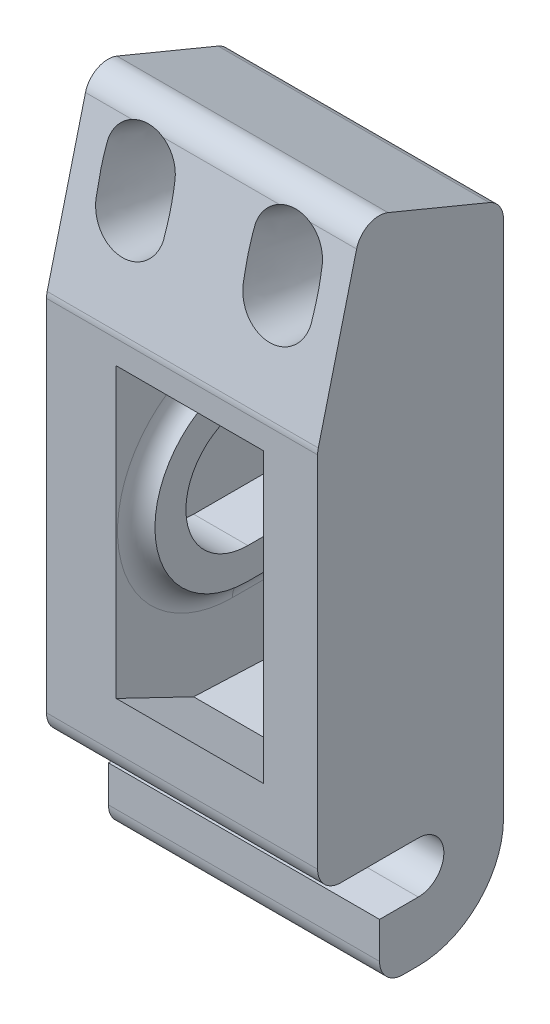
from build123d import *

# Parameters (mm, degrees)
SKETCH1_W              = 17.5
SKETCH1_H              = 44
BLOCK_DEPTH            = 12
BEARINGHOLECOVER_REACH = 49.424
HINGEHOLE_REACH        = 50.849
SKETCH4_R              = 1.65
SKETCH5_W              = 4
SKETCH5_H              = 3.85
HINGEHOLECLEAR1_DEPTH  = 49.849257951
SKETCH8_W              = 6.5
SKETCH8_H              = 3.3
HINGEHOLECLEAR2_DEPTH  = 49.849257951
BEARINGAXIS_DEPTH      = 12
BEARINGAXIS_DEPTH_BACK = 2.5
SKETCH16_W             = 1
SKETCH16_H             = 2
SKETCH18_W             = 1
SKETCH18_H             = 2
SWEEPFILLET_R          = 1.5
HINGEFILLET_R          = 5.5
CUT_REACH              = 50.849
CHAMFER_START          = 36.9551813
CHAMFER_2_OUTLINE_W    = 20
CHAMFER_2_OUTLINE_H    = 13
CHAMFER_2_DEPTH        = 5.0448187
FILLET15MM_START       = -1
FILLET15MM_DEPTH       = 19


with BuildPart() as part:
    # Sketch1 → Block (new body)
    with BuildSketch(Plane.XY):
        with Locations((8.75, 22)):
            Rectangle(SKETCH1_W, SKETCH1_H)
    extrude(amount=BLOCK_DEPTH)

    # Sketch2 → BearingHole section 0
    with BuildSketch(Plane.XY.offset(12)):
        with BuildLine():
            Line((4.5, 9.5), (14, 9.5))
            Line((14, 9.5), (14, 32.5))
            Line((14, 32.5), (4.5, 32.5))
            Line((4.5, 32.5), (4.5, 9.5))
        make_face()
    # Sketch3 → BearingHole section 1
    with BuildSketch(Plane(origin=(0, 0, 0), x_dir=(-1, 0, 0), z_dir=(0, 0, -1))):
        with BuildLine():
            Line((-14, 9), (-4.5, 9))
            Line((-4.5, 9), (-4.5, 33))
            Line((-4.5, 33), (-14, 33))
            Line((-14, 33), (-14, 9))
        make_face()
    loft(mode=Mode.SUBTRACT)

    # Sketch32 → BearingHoleCover (add, up to next)
    with BuildSketch(Plane(origin=(4.5, 0, 0), x_dir=(0, 0, -1), z_dir=(1, 0, 0)), mode=Mode.PRIVATE) as bearingholecover_sk1:
        Polygon((-12, 32.5), (-7, 32.708333333), (-12, 30.3), align=None)
    bearingholecover_tool1 = extrude(bearingholecover_sk1.sketch, amount=BEARINGHOLECOVER_REACH, mode=Mode.PRIVATE) - part.part
    # Sketch32 → BearingHoleCover (add, up to next)
    with BuildSketch(Plane(origin=(4.5, 0, 0), x_dir=(0, 0, -1), z_dir=(1, 0, 0)), mode=Mode.PRIVATE) as bearingholecover_sk2:
        Polygon((-12, 9.5), (-7, 9.291666667), (-12, 11.7), align=None)
    bearingholecover_tool2 = extrude(bearingholecover_sk2.sketch, amount=BEARINGHOLECOVER_REACH, mode=Mode.PRIVATE) - part.part
    add(bearingholecover_tool1.solids().sort_by_distance((4.5, 31.836111, 10.333333))[0])
    add(bearingholecover_tool2.solids().sort_by_distance((4.5, 10.163889, 10.333333))[0])

    # Sketch4 → HingeHole (cut, up to next)
    with BuildSketch(Plane(origin=(17.5, 0, 0), x_dir=(0, 0, -1), z_dir=(1, 0, 0)), mode=Mode.PRIVATE) as hingehole_sk1:
        with Locations((-5.5, 5.5)):
            Circle(SKETCH4_R)
    hingehole_tool1 = extrude(hingehole_sk1.sketch, amount=-HINGEHOLE_REACH, mode=Mode.PRIVATE) & part.part
    add(hingehole_tool1.solids().sort_by_distance((17.5, 5.5, 5.5))[0], mode=Mode.SUBTRACT)

    # Sketch5 → HingeHoleClear1 (cut, through all)
    with BuildSketch(Plane(origin=(17.5, 0, 0), x_dir=(0, 0, -1), z_dir=(1, 0, 0))):
        with Locations((-10, 1.925)):
            Rectangle(SKETCH5_W, SKETCH5_H)
    extrude(amount=-HINGEHOLECLEAR1_DEPTH, mode=Mode.SUBTRACT)

    # Sketch8 → HingeHoleClear2 (cut, through all)
    with BuildSketch(Plane(origin=(17.5, 0, 0), x_dir=(0, 0, -1), z_dir=(1, 0, 0))):
        with Locations((-8.75, 5.5)):
            Rectangle(SKETCH8_W, SKETCH8_H)
    extrude(amount=-HINGEHOLECLEAR2_DEPTH, mode=Mode.SUBTRACT)

    # Sketch10 → BearingAxis (cut, two sides: drawn at the far end of the back side and taken through both)
    with BuildSketch(Plane(origin=(4.5, 0, 0), x_dir=(0, 0, -1), z_dir=(1, 0, 0)).offset(-BEARINGAXIS_DEPTH_BACK)):
        with BuildLine():
            Line((0, 25), (-4.5, 25))
            ThreePointArc((-4.5, 25), (-8.5, 21), (-4.5, 17))
            Line((-4.5, 17), (0, 17))
            Line((0, 17), (0, 25))
        make_face()
    extrude(amount=BEARINGAXIS_DEPTH + BEARINGAXIS_DEPTH_BACK, mode=Mode.SUBTRACT)

    # Sweep1: sweep along a path in Sketch15
    with BuildLine(Plane(origin=(4.5, 0, 0), x_dir=(0, 0, -1), z_dir=(1, 0, 0))) as sweep1_path:
        Line((0, 17), (-4.5, 17))
        ThreePointArc((-4.5, 17), (-8.5, 21), (-4.5, 25))
        Line((-4.5, 25), (0, 25))
    # Sketch16 → Sweep1 (sweep)
    with BuildSketch(Plane(origin=(0, 0, 0), x_dir=(-1, 0, 0), z_dir=(0, 0, -1))):
        with Locations((-5, 26)):
            Rectangle(SKETCH16_W, SKETCH16_H)
    sweep(path=sweep1_path.line)

    # Sweep2: sweep along a path in Sketch17
    with BuildLine(Plane.ZY.offset(-14)) as sweep2_path:
        Line((0, 17), (4.5, 17))
        ThreePointArc((4.5, 17), (8.5, 21), (4.5, 25))
        Line((4.5, 25), (0, 25))
    # Sketch18 → Sweep2 (sweep)
    with BuildSketch(Plane(origin=(0, 0, 0), x_dir=(-1, 0, 0), z_dir=(0, 0, -1))):
        with Locations((-13.5, 26)):
            Rectangle(SKETCH18_W, SKETCH18_H)
    sweep(path=sweep2_path.line)

    # SweepFillet
    # the kernel refuses this fillet: 1.5 mm, written as the material it adds along each edge
    with BuildSketch(Plane(origin=(4.5, 15, 0), x_dir=(0, -1, 0), z_dir=(0, 0, 1)), Plane(origin=(4.5, 27, 4.5), x_dir=(0, 1, 0), z_dir=(0, 0, -1))) as sweepfillet_piece_1:
        with BuildLine():
            CenterArc((1.414213562, 1.5), SWEEPFILLET_R, 199.471220634, 70.528779366)
            Line((0, 1), (-0.028284271, 0.99))
            ThreePointArc((-0.028284271, 0.99), (-0.03, 0.5), (-0.03, 0))
            Line((-0.03, 0), (0, -0.03))
            Line((0, -0.03), (1.414213562, -0.03))
            Line((1.414213562, -0.03), (1.414213562, 0))
        make_face()
    extrude(amount=4.5)
    with BuildSketch(Plane(origin=(4.5, 21, 4.5), x_dir=(0, -1, 0), z_dir=(0, 0, -1))) as sweepfillet_piece_2:
        with BuildLine():
            CenterArc((7.414213562, -1.5), SWEEPFILLET_R, 90, 70.528779366)
            Line((6, -1), (5.971715729, -0.99))
            ThreePointArc((5.971715729, -0.99), (5.97, -0.5), (5.97, 0))
            Line((5.97, 0), (6, 0.03))
            Line((6, 0.03), (7.414213562, 0.03))
            Line((7.414213562, 0.03), (7.414213562, 0))
        make_face()
    revolve(axis=Axis((4.5, 21, 4.5), (-1, 0, 0)), revolution_arc=180)
    with BuildSketch(Plane(origin=(14, 15, 0), x_dir=(0, -1, 0), z_dir=(0, 0, 1)), Plane(origin=(14, 27, 4.5), x_dir=(0, 1, 0), z_dir=(0, 0, -1))) as sweepfillet_piece_3:
        with BuildLine():
            CenterArc((1.414213562, -1.5), SWEEPFILLET_R, 90, 70.528779366)
            Line((0, -1), (-0.028284271, -0.99))
            ThreePointArc((-0.028284271, -0.99), (-0.03, -0.5), (-0.03, 0))
            Line((-0.03, 0), (0, 0.03))
            Line((0, 0.03), (1.414213562, 0.03))
            Line((1.414213562, 0.03), (1.414213562, 0))
        make_face()
    extrude(amount=4.5)
    with BuildSketch(Plane(origin=(14, 21, 4.5), x_dir=(0, -1, 0), z_dir=(0, 0, -1))) as sweepfillet_piece_4:
        with BuildLine():
            CenterArc((7.414213562, 1.5), SWEEPFILLET_R, 199.471220634, 70.528779366)
            Line((6, 1), (5.971715729, 0.99))
            ThreePointArc((5.971715729, 0.99), (5.97, 0.5), (5.97, 0))
            Line((5.97, 0), (6, -0.03))
            Line((6, -0.03), (7.414213562, -0.03))
            Line((7.414213562, -0.03), (7.414213562, 0))
        make_face()
    revolve(axis=Axis((14, 21, 4.5), (-1, 0, 0)), revolution_arc=180)

    # HingeFillet
    hingefillet_edges = [part.edges().sort_by_distance(p)[0] for p in [
        (8.75, 0, 0),
    ]]
    fillet(hingefillet_edges, radius=HINGEFILLET_R)

    # ScrewLoft1: read off the stored shape, not the designer's step
    # ScrewLoft1: loft between two sections, ruled curve by curve
    screwloft1_from = [
        Edge.make_bspline([(11.627886838, 35.251924558, 0), (11.736342568, 35.089240964, 0), (11.989925627, 34.800398608, 0), (12.450798666, 34.484302155, 0), (12.962653807, 34.292965367, 0), (13.5, 34.228486888, 0), (14.037346193, 34.292965367, 0), (14.549201334, 34.484302155, 0), (15.010074373, 34.800398608, 0), (15.263657432, 35.089240964, 0), (15.481947086, 35.416675445, 0), (15.674009487, 35.799471542, 0), (15.788344959, 36.5, 0), (15.674009487, 37.200528458, 0), (15.481947086, 37.583324555, 0), (15.263657432, 37.910759036, 0), (15.010074373, 38.199601392, 0), (14.549201334, 38.515697845, 0), (14.037346193, 38.707034633, 0), (13.5, 38.771513112, 0), (12.962653807, 38.707034633, 0), (12.450798666, 38.515697845, 0), (11.989925627, 38.199601392, 0), (11.736342568, 37.910759036, 0), (11.518052914, 37.583324555, 0), (11.325990513, 37.200528458, 0), (11.211655041, 36.5, 0), (11.325990513, 35.799471542, 0), (11.518052914, 35.416675445, 0), (11.627886838, 35.251924558, 0)], [0, 0, 0, 0, 0.041490919, 0.082981838, 0.124472757, 0.165963676, 0.207454595, 0.248945514, 0.290436432, 0.331927351, 0.331927351, 0.373945514, 0.415963676, 0.457981838, 0.5, 0.5, 0.541490919, 0.582981838, 0.624472757, 0.665963676, 0.707454595, 0.748945514, 0.790436432, 0.831927351, 0.831927351, 0.873945514, 0.915963676, 0.957981838, 1, 1, 1, 1], 3),
    ]
    screwloft1_to = [
        Edge.make_bspline([(11.25, 38.000000001, 12), (11.25, 37.721496815, 12), (11.354724554, 37.153108145, 12), (11.836769335, 36.397508487, 12), (12.590441949, 35.874704414, 12), (13.5, 35.687464943, 12), (14.409558051, 35.874704414, 12), (15.163230665, 36.397508487, 12), (15.645275446, 37.153108145, 12), (15.75, 37.721496815, 12), (15.75, 38.282042249, 12), (15.75, 38.790019597, 12), (15.75, 39.5, 12), (15.75, 40.209980403, 12), (15.75, 40.717957751, 12), (15.75, 41.278503185, 12), (15.645275446, 41.846891855, 12), (15.163230665, 42.602491513, 12), (14.409558051, 43.125295586, 12), (13.5, 43.312535057, 12), (12.590441949, 43.125295586, 12), (11.836769335, 42.602491513, 12), (11.354724554, 41.846891855, 12), (11.25, 41.278503185, 12), (11.25, 40.717957751, 12), (11.25, 40.209980403, 12), (11.25, 39.5, 12), (11.25, 38.790019597, 12), (11.25, 38.282042249, 12), (11.25, 38.000000001, 12)], [0, 0, 0, 0, 0.041490919, 0.082981838, 0.124472757, 0.165963676, 0.207454595, 0.248945514, 0.290436432, 0.331927351, 0.331927351, 0.373945514, 0.415963676, 0.457981838, 0.5, 0.5, 0.541490919, 0.582981838, 0.624472757, 0.665963676, 0.707454595, 0.748945514, 0.790436432, 0.831927351, 0.831927351, 0.873945514, 0.915963676, 0.957981838, 1, 1, 1, 1], 3),
    ]
    screwloft1 = Solid(Shell([*[Face.make_surface_from_curves(screwloft1_from[k], screwloft1_to[k]) for k in range(1)], Face(Wire(screwloft1_from)), Face(Wire(screwloft1_to))]))
    add(screwloft1, mode=Mode.SUBTRACT)

    # ScrewLoft2: read off the stored shape, not the designer's step
    # ScrewLoft2: loft between two sections, ruled curve by curve
    screwloft2_from = [
        Edge.make_bspline([(6.25, 38.000000001, 12), (6.25, 37.721496815, 12), (6.145275446, 37.153108145, 12), (5.663230665, 36.397508487, 12), (4.909558051, 35.874704414, 12), (4, 35.687464943, 12), (3.090441949, 35.874704414, 12), (2.336769335, 36.397508487, 12), (1.854724554, 37.153108145, 12), (1.75, 37.721496815, 12), (1.75, 38.282042249, 12), (1.75, 38.790019597, 12), (1.75, 39.5, 12), (1.75, 40.209980403, 12), (1.75, 40.717957751, 12), (1.75, 41.278503185, 12), (1.854724554, 41.846891855, 12), (2.336769335, 42.602491513, 12), (3.090441949, 43.125295586, 12), (4, 43.312535057, 12), (4.909558051, 43.125295586, 12), (5.663230665, 42.602491513, 12), (6.145275446, 41.846891855, 12), (6.25, 41.278503185, 12), (6.25, 40.717957751, 12), (6.25, 40.209980403, 12), (6.25, 39.5, 12), (6.25, 38.790019597, 12), (6.25, 38.282042249, 12), (6.25, 38.000000001, 12)], [0, 0, 0, 0, 0.041490919, 0.082981838, 0.124472757, 0.165963676, 0.207454595, 0.248945514, 0.290436432, 0.331927351, 0.331927351, 0.373945514, 0.415963676, 0.457981838, 0.5, 0.5, 0.541490919, 0.582981838, 0.624472757, 0.665963676, 0.707454595, 0.748945514, 0.790436432, 0.831927351, 0.831927351, 0.873945514, 0.915963676, 0.957981838, 1, 1, 1, 1], 3),
    ]
    screwloft2_to = [
        Edge.make_bspline([(5.872113162, 35.251924558, 0), (5.763657432, 35.089240964, 0), (5.510074373, 34.800398608, 0), (5.049201334, 34.484302155, 0), (4.537346193, 34.292965367, 0), (4, 34.228486888, 0), (3.462653807, 34.292965367, 0), (2.950798666, 34.484302155, 0), (2.489925627, 34.800398608, 0), (2.236342568, 35.089240964, 0), (2.018052914, 35.416675445, 0), (1.825990513, 35.799471542, 0), (1.711655041, 36.5, 0), (1.825990513, 37.200528458, 0), (2.018052914, 37.583324555, 0), (2.236342568, 37.910759036, 0), (2.489925627, 38.199601392, 0), (2.950798666, 38.515697845, 0), (3.462653807, 38.707034633, 0), (4, 38.771513112, 0), (4.537346193, 38.707034633, 0), (5.049201334, 38.515697845, 0), (5.510074373, 38.199601392, 0), (5.763657432, 37.910759036, 0), (5.981947086, 37.583324555, 0), (6.174009487, 37.200528458, 0), (6.288344959, 36.5, 0), (6.174009487, 35.799471542, 0), (5.981947086, 35.416675445, 0), (5.872113162, 35.251924558, 0)], [0, 0, 0, 0, 0.041490919, 0.082981838, 0.124472757, 0.165963676, 0.207454595, 0.248945514, 0.290436432, 0.331927351, 0.331927351, 0.373945514, 0.415963676, 0.457981838, 0.5, 0.5, 0.541490919, 0.582981838, 0.624472757, 0.665963676, 0.707454595, 0.748945514, 0.790436432, 0.831927351, 0.831927351, 0.873945514, 0.915963676, 0.957981838, 1, 1, 1, 1], 3),
    ]
    screwloft2 = Solid(Shell([*[Face.make_surface_from_curves(screwloft2_from[k], screwloft2_to[k]) for k in range(1)], Face(Wire(screwloft2_from)), Face(Wire(screwloft2_to))]))
    add(screwloft2, mode=Mode.SUBTRACT)

    # Sketch34 → Cut (cut, up to next)
    with BuildSketch(Plane.ZY, mode=Mode.PRIVATE) as cut_sk1:
        Polygon((12, 44), (9, 44), (12, 32), align=None)
    cut_tool1 = extrude(cut_sk1.sketch, amount=-CUT_REACH, mode=Mode.PRIVATE) & part.part
    add(cut_tool1.solids().sort_by_distance((0, 40, 11))[0], mode=Mode.SUBTRACT)

    # Chamfer 2: read off the stored shape, not the designer's step
    # Chamfer 2 outline → Chamfer 2 (cut)
    with BuildSketch(Plane(origin=(0, 0, 0), x_dir=(1, 0, 0), z_dir=(0, 0.9238795325112883, -0.3826834323650861)).offset(CHAMFER_START)):
        with Locations((9, -20.5)):
            Rectangle(CHAMFER_2_OUTLINE_W, CHAMFER_2_OUTLINE_H)
    extrude(amount=CHAMFER_2_DEPTH, mode=Mode.SUBTRACT)

    # Fillet15mm: read off the stored shape, not the designer's step
    # Fillet15mm outline → Fillet15mm (cut)
    with BuildSketch(Plane.YZ.offset(FILLET15MM_START)):
        with BuildLine():
            ThreePointArc((7.15, 10.5), (7.589339828, 11.560660172), (8.65, 12))
            Line((8.65, 12), (7.15, 12))
            Line((7.15, 12), (7.15, 10.5))
        make_face()
        with BuildLine():
            ThreePointArc((31.815341562, 12), (31.998616457, 11.988761335), (32.179144999, 11.95521375))
            Line((32.179144999, 11.95521375), (32, 12))
            Line((32, 12), (31.815341562, 12))
        make_face()
        with BuildLine():
            Line((40, 0), (40.383551342, 0.925974851))
            ThreePointArc((40.383551342, 0.925974851), (39.831087392, 0.252795582), (38.997732043, 0))
            Line((38.997732043, 0), (40, 0))
        make_face()
        with BuildLine():
            ThreePointArc((42.065673948, 9.483581513), (43.041552397, 8.703091738), (43.087689809, 7.454342614))
            Line((43.087689809, 7.454342614), (43.753452854, 9.061636786))
            Line((43.753452854, 9.061636786), (42.065673948, 9.483581513))
        make_face()
        with BuildLine():
            ThreePointArc((0, 6.5), (0.439339828, 7.560660172), (1.5, 8))
            Line((1.5, 8), (0, 8))
            Line((0, 8), (0, 6.5))
        make_face()
    extrude(amount=FILLET15MM_DEPTH, mode=Mode.SUBTRACT)


solid = part.part
